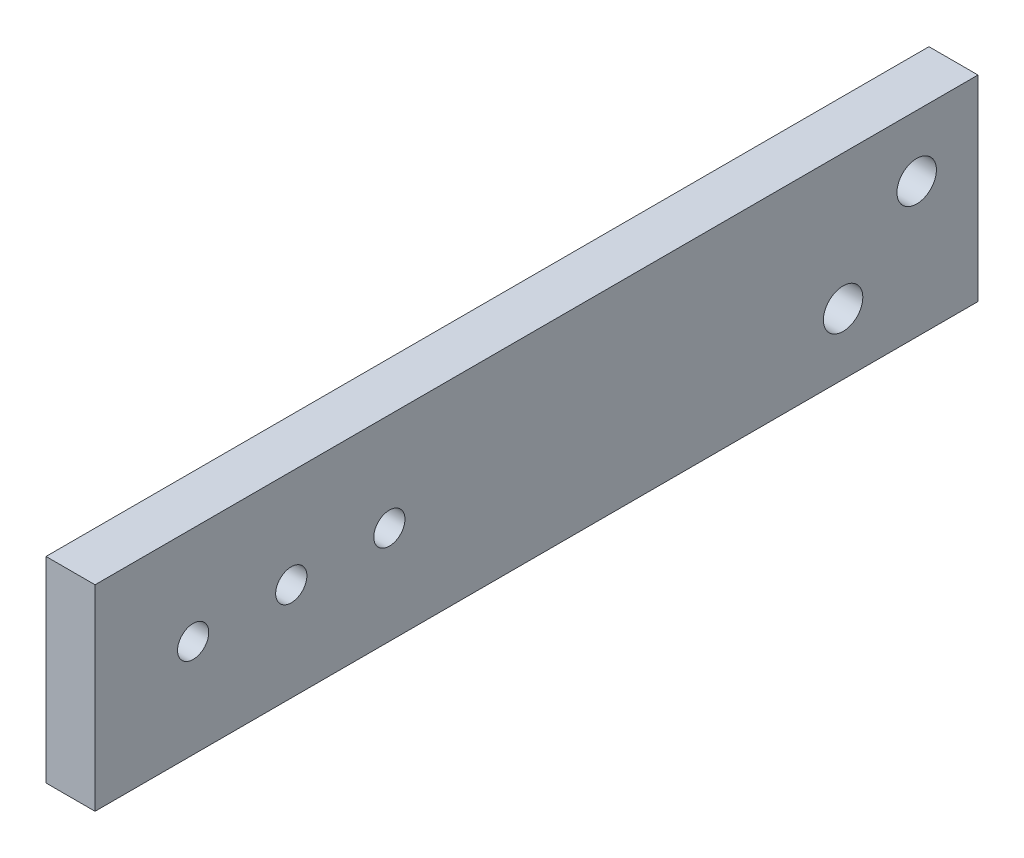
from build123d import *

# Parameters (mm, degrees)
SKETCH1_W              = 114.3
SKETCH1_H              = 25.4
BOSS_EXTRUDE1_DEPTH    = 6.35
F_10_32_TAPPED_HOLE1_D = 4.0386
F_10_CLEARANCE_HOLE1_D = 5.1054


with BuildPart() as part:
    # Sketch1 → Boss-Extrude1 (new body)
    with BuildSketch(Plane(origin=(0, 0, 0), x_dir=(0, 0, -1), z_dir=(1, 0, 0))):
        with Locations((57.15, 12.7)):
            Rectangle(SKETCH1_W, SKETCH1_H)
    extrude(amount=BOSS_EXTRUDE1_DEPTH)

    # #10-32 Tapped Hole1 (through all)
    with Locations(Plane(origin=(6.35, 0, 0), x_dir=(0, 0, -1), z_dir=(1, 0, 0))):
        with Locations((12.7, 12.7), (25.4, 12.7), (38.1, 12.7)):
            Hole(F_10_32_TAPPED_HOLE1_D / 2)

    # #10 Clearance Hole1 (through all)
    with Locations(Plane(origin=(6.35, 0, 0), x_dir=(0, 0, -1), z_dir=(1, 0, 0))):
        with Locations((106.3625, 17.4625), (96.8375, 7.9375)):
            Hole(F_10_CLEARANCE_HOLE1_D / 2)


solid = part.part
